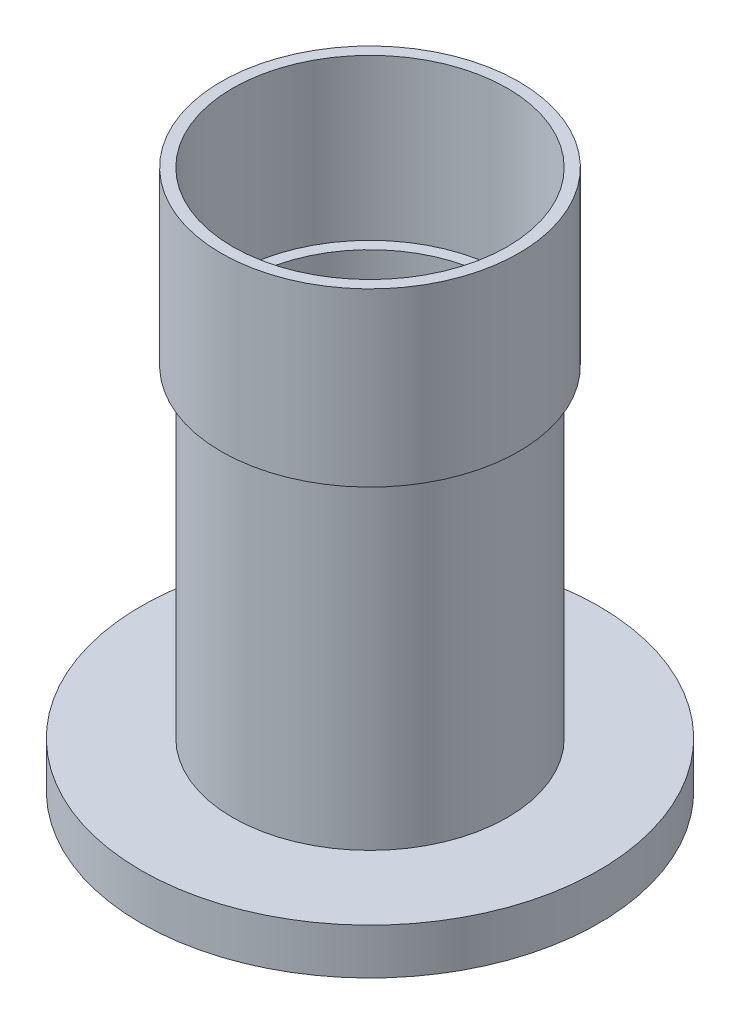
from build123d import *

# Parameters (mm, degrees)
SKETCH1_R           = 31.75
BOSS_EXTRUDE1_DEPTH = 6.35


with BuildPart() as part:
    # Sketch1 → Boss-Extrude1 (new body)
    with BuildSketch(Plane(origin=(0, 0, 0), x_dir=(1, 0, 0), z_dir=(0, 1, 0))):
        Circle(SKETCH1_R)
    extrude(amount=BOSS_EXTRUDE1_DEPTH)

    # Sketch2 → Revolve1 (revolve)
    with BuildSketch(Plane.XY):
        Polygon((19.05, 6.35), (19.05, 51.1175), (20.6375, 51.1175), (20.6375, 74.93), (19.05, 74.93), (19.05, 52.705), (17.4625, 52.705), (17.4625, 6.35), align=None)
    revolve(axis=Axis((0, -26.067472827, 0), (0, 1, 0)))


solid = part.part
